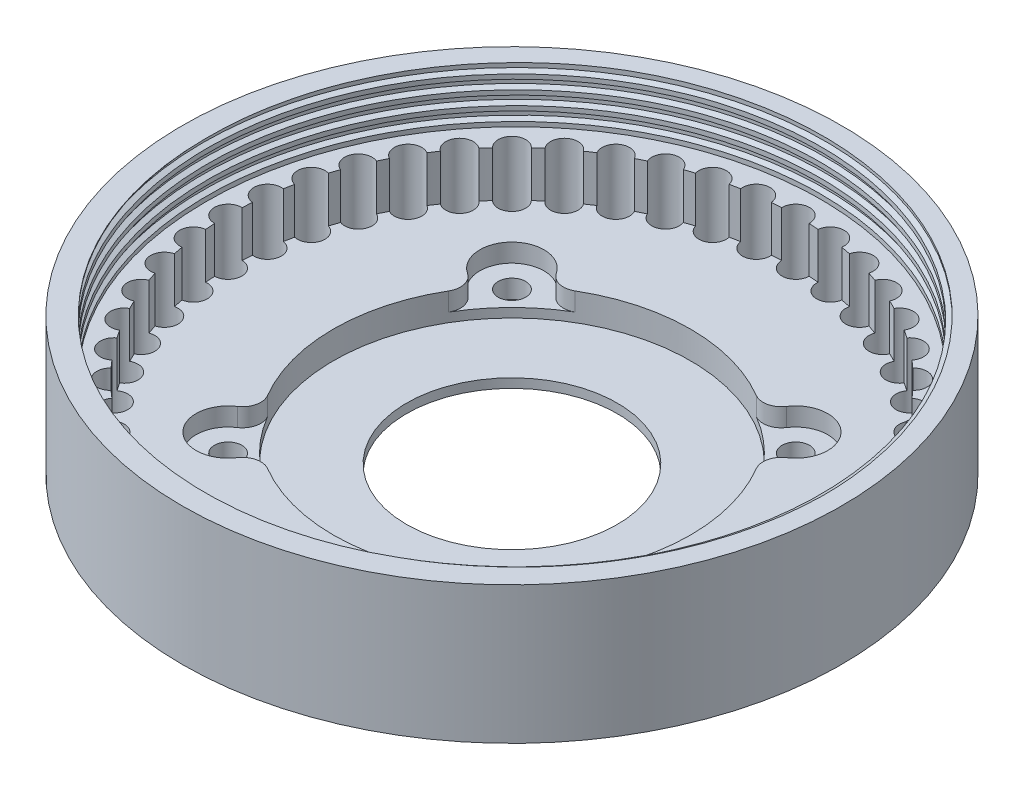
from build123d import *

# Parameters (mm, degrees)
SKETCH1_R           = 36
BOSS_EXTRUDE1_DEPTH = 15
SKETCH2_R           = 33.5
CUT_EXTRUDE4_DEPTH  = 6
SKETCH4_R           = 1.5
CUT_EXTRUDE5_DEPTH  = 8
CIRPATTERN2_COUNT   = 48
SKETCH5_R           = 31
CUT_EXTRUDE6_DEPTH  = 5
SKETCH6_R           = 19.5
CUT_EXTRUDE7_DEPTH  = 3
SKETCH7_R           = 1.5
CUT_EXTRUDE8_DEPTH  = 53.086466572
SKETCH9_R           = 3.5
CUT_EXTRUDE9_DEPTH  = 2
FILLET1_R           = 2
SKETCH10_R          = 11.5
CUT_EXTRUDE10_DEPTH = 53.80151513
CUT_SWEEP5_PITCH    = 1.5
CUT_SWEEP5_FROM     = 0


with BuildPart() as part:
    # Sketch1 → Boss-Extrude1 (new body)
    with BuildSketch(Plane(origin=(0, 0, 0), x_dir=(1, 0, 0), z_dir=(0, 1, 0))):
        with Locations(Location((0, 0, 0), (0, 0, 270))):
            Circle(SKETCH1_R)
    extrude(amount=BOSS_EXTRUDE1_DEPTH)

    # Sketch2 → Cut-Extrude4 (cut)
    with BuildSketch(Plane(origin=(0, 15, 0), x_dir=(1, 0, 0), z_dir=(0, 1, 0))):
        with Locations(Location((0, 0, 0), (0, 0, 270))):
            Circle(SKETCH2_R)
    extrude(amount=-CUT_EXTRUDE4_DEPTH, mode=Mode.SUBTRACT)

    # Sketch4 → Cut-Extrude5 (cut)
    with BuildSketch(Plane(origin=(0, 9, 0), x_dir=(1, 0, 0), z_dir=(0, 1, 0))):
        with Locations(Location((0, 31, 0), (0, 0, 270))):
            Circle(SKETCH4_R)
    cut_extrude5 = extrude(amount=-CUT_EXTRUDE5_DEPTH, mode=Mode.SUBTRACT)

    # CirPattern2: Cut-Extrude5 ×48 about axis
    cirpattern2_axis = Axis((0, 0, 0), (0, 1, 0))
    for i in range(1, CIRPATTERN2_COUNT):
        add(cut_extrude5.rotate(cirpattern2_axis, i * 360 / CIRPATTERN2_COUNT), mode=Mode.SUBTRACT)

    # Sketch5 → Cut-Extrude6 (cut)
    with BuildSketch(Plane(origin=(0, 9, 0), x_dir=(1, 0, 0), z_dir=(0, 1, 0))):
        Circle(SKETCH5_R)
    extrude(amount=-CUT_EXTRUDE6_DEPTH, mode=Mode.SUBTRACT)

    # Sketch6 → Cut-Extrude7 (cut)
    with BuildSketch(Plane(origin=(0, 4, 0), x_dir=(1, 0, 0), z_dir=(0, 1, 0))):
        with Locations(Location((0, 0, 0), (0, 0, 270))):
            Circle(SKETCH6_R)
    extrude(amount=-CUT_EXTRUDE7_DEPTH, mode=Mode.SUBTRACT)

    # Sketch7 → Cut-Extrude8 (cut, through all)
    with BuildSketch(Plane(origin=(0, 4, 0), x_dir=(1, 0, 0), z_dir=(0, 1, 0))):
        with Locations(Location((15.5, 15.5, 0), (0, 0, 270))):
            Circle(SKETCH7_R)
        with Locations(Location((15.5, -15.5, 0), (0, 0, 270))):
            Circle(SKETCH7_R)
        with Locations(Location((-15.5, 15.5, 0), (0, 0, 270))):
            Circle(SKETCH7_R)
        with Locations(Location((-15.5, -15.5, 0), (0, 0, 270))):
            Circle(SKETCH7_R)
    extrude(amount=-CUT_EXTRUDE8_DEPTH, mode=Mode.SUBTRACT)

    # Sketch9 → Cut-Extrude9 (cut)
    with BuildSketch(Plane(origin=(0, 4, 0), x_dir=(1, 0, 0), z_dir=(0, 1, 0))):
        with Locations((15.5, 15.5)):
            Circle(SKETCH9_R)
        with Locations((-15.5, 15.5)):
            Circle(SKETCH9_R)
        with Locations((-15.5, -15.5)):
            Circle(SKETCH9_R)
        with Locations((15.5, -15.5)):
            Circle(SKETCH9_R)
    extrude(amount=-CUT_EXTRUDE9_DEPTH, mode=Mode.SUBTRACT)

    # Fillet1
    fillet1_edges = [part.edges().sort_by_distance(p)[0] for p in [
        (15.368496413, 3, -12.002471329),
        (12.002471329, 3, -15.368496413),
        (-12.002471329, 3, -15.368496413),
        (-15.368496413, 3, -12.002471329),
        (-15.368496413, 3, 12.002471329),
        (-12.002471329, 3, 15.368496413),
        (12.002471329, 3, 15.368496413),
        (15.368496413, 3, 12.002471329),
    ]]
    fillet(fillet1_edges, radius=FILLET1_R)

    # Sketch10 → Cut-Extrude10 (cut, through all)
    with BuildSketch(Plane(origin=(0, 1, 0), x_dir=(1, 0, 0), z_dir=(0, 1, 0))):
        with Locations(Location((0, 0, 0), (0, 0, 270))):
            Circle(SKETCH10_R)
    extrude(amount=-CUT_EXTRUDE10_DEPTH, mode=Mode.SUBTRACT)

    # Cut-Sweep5: arcs per turn and ends read off the stored shape
    # Cut-Sweep5: the profile of Sketch14 profile screwed along a left-hand helix through 6 turns, 8 arcs to a turn; built about Z, then put on its axis
    cut_sweep5_z = Axis((0, 0, 0), (0, 0, 1))
    cut_sweep5_corners = [(33.4997, 0, -1.49985), (33.4997, 0, -2.50015), (34, 0, -2.25), (34, 0, -1.75)]
    with BuildLine(mode=Mode.PRIVATE) as cut_sweep5_profile:
        Line(cut_sweep5_corners[0], cut_sweep5_corners[1])
        Line(cut_sweep5_corners[1], cut_sweep5_corners[2])
        Line(cut_sweep5_corners[2], cut_sweep5_corners[3])
        Line(cut_sweep5_corners[3], cut_sweep5_corners[0])
    cut_sweep5_cap = Face(cut_sweep5_profile.wire())
    cut_sweep5_turn_angles = [0, -22.5, -45, -67.5, -90, -112.5, -135, -157.5, -180, -202.5, -225, -247.5, -270, -292.5, -315, -337.5, -360]
    cut_sweep5_turn_weights = [1, 0.9238795325112867, 1, 0.9238795325112867, 1, 0.9238795325112867, 1, 0.9238795325112867, 1, 0.9238795325112867, 1, 0.9238795325112867, 1, 0.9238795325112867, 1, 0.9238795325112867, 1]
    cut_sweep5_turn_rails = [Edge.make_bspline([Vector(p[0], p[1], 0).rotate(cut_sweep5_z, cut_sweep5_turn_angles[k]) / cut_sweep5_turn_weights[k] + Vector(0, 0, p[2] + -CUT_SWEEP5_PITCH * cut_sweep5_turn_angles[k] / 360) for k in range(17)], [0, 0, 0, 1, 1, 2, 2, 3, 3, 4, 4, 5, 5, 6, 6, 7, 7, 8, 8, 8], 2, cut_sweep5_turn_weights) for p in cut_sweep5_corners]
    cut_sweep5_turn_sides = [Face.make_surface_from_curves(cut_sweep5_turn_rails[p[0]], cut_sweep5_turn_rails[p[1]]) for p in [(0, 1), (1, 2), (2, 3), (3, 0)]]
    cut_sweep5 = Plane(origin=(0, 9, 0), x_dir=(-1, 0, 0), z_dir=(0, 1, 0)) * split(Solid(Shell([*[p.moved(Location((0, 0, CUT_SWEEP5_PITCH * i))) for i in range(6) for p in cut_sweep5_turn_sides], cut_sweep5_cap, cut_sweep5_cap.rotate(cut_sweep5_z, -2160).moved(Location((0, 0, -CUT_SWEEP5_PITCH * -2160 / 360)))])), bisect_by=Plane.XY.offset(CUT_SWEEP5_FROM), keep=Keep.TOP, mode=Mode.PRIVATE)
    add(cut_sweep5, mode=Mode.SUBTRACT)


solid = part.part
